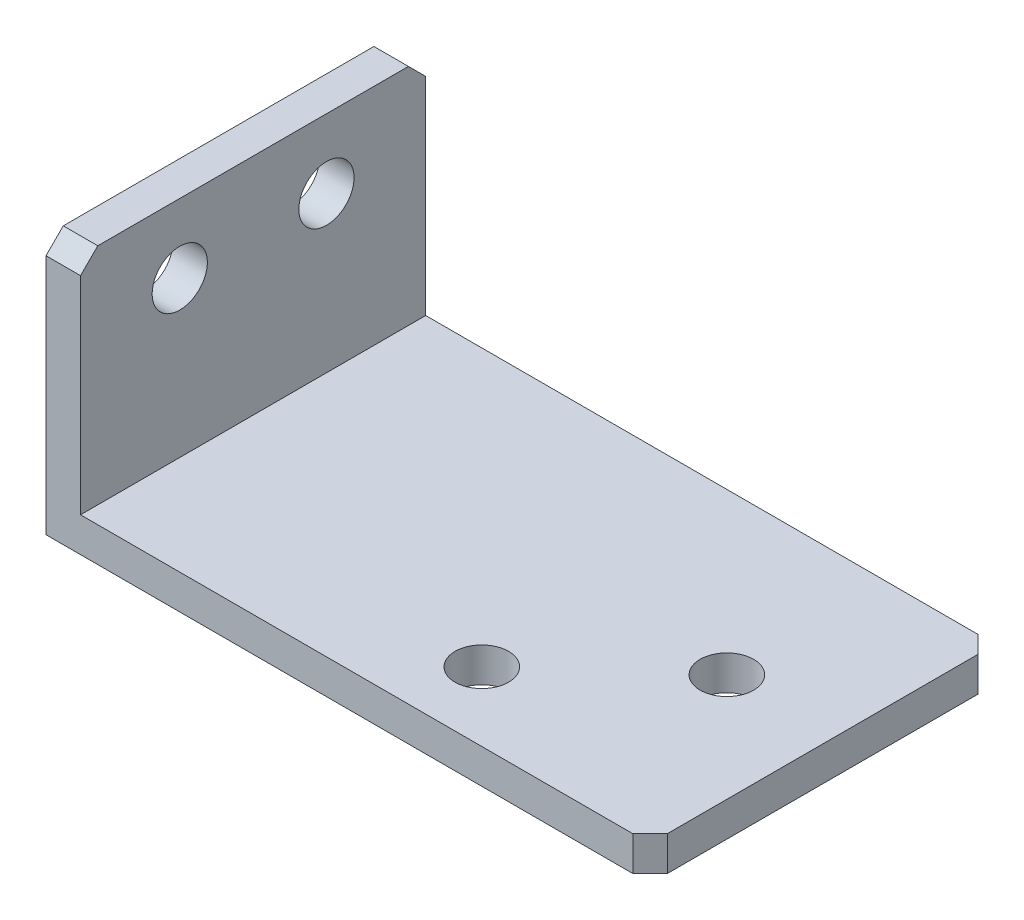
from build123d import *

# Parameters (mm, degrees)
BASE_DEPTH                 = 20
SKETCH5_R                  = 1.55
CABLECHAINSIDE_DEPTH       = 43.355637169
CHAMFER1_SIZE              = 1
F_3_2_3_2_DIAMETER_HOLE1_D = 3.2


with BuildPart() as part:
    # Sketch1 → Base (new body)
    with BuildSketch(Plane.XY):
        Polygon((0, 0), (35, 0), (35, 2), (2, 2), (2, 15), (0, 15), align=None)
    extrude(amount=BASE_DEPTH)

    # Sketch5 → CableChainSide (cut, through all)
    with BuildSketch(Plane(origin=(0, 2, 0), x_dir=(1, 0, 0), z_dir=(0, 1, 0))):
        with Locations((21.25, -16)):
            Circle(SKETCH5_R)
        with Locations((28.75, -9.3)):
            Circle(SKETCH5_R)
    extrude(amount=-CABLECHAINSIDE_DEPTH, mode=Mode.SUBTRACT)

    # Chamfer1
    chamfer1_edges = [part.edges().sort_by_distance(p)[0] for p in [
        (35, 1, 0),
        (1, 15, 0),
        (1, 15, 20),
        (35, 1, 20),
    ]]
    chamfer(chamfer1_edges, length=CHAMFER1_SIZE)

    # Ø3.2 (3.2) Diameter Hole1 (through all)
    with Locations(Plane.ZY):
        with Locations((5.75, 11), (14.25, 11)):
            Hole(F_3_2_3_2_DIAMETER_HOLE1_D / 2)


solid = part.part
